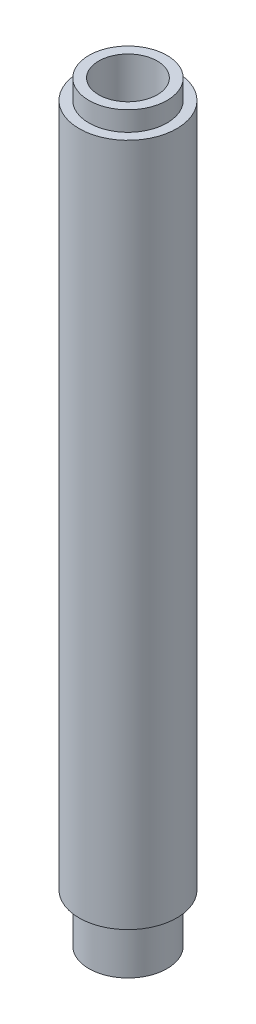
from build123d import *

# Parameters (mm, degrees)
SKETCH1_R           = 12.7
BOSS_EXTRUDE1_DEPTH = 177.8
SKETCH4_R           = 10.16
BOSS_EXTRUDE2_DEPTH = 5.08
SKETCH5_R           = 7.62
CUT_EXTRUDE1_DEPTH  = 184.759828036
SKETCH6_R           = 10.16
SKETCH6_R_2         = 7.62
BOSS_EXTRUDE3_DEPTH = 12.7


with BuildPart() as part:
    # Sketch1 → Boss-Extrude1 (new body)
    with BuildSketch(Plane(origin=(0, 0, 0), x_dir=(1, 0, 0), z_dir=(0, 1, 0))):
        Circle(SKETCH1_R)
    extrude(amount=BOSS_EXTRUDE1_DEPTH)

    # Sketch4 → Boss-Extrude2 (add)
    with BuildSketch(Plane(origin=(0, 177.8, 0), x_dir=(1, 0, 0), z_dir=(0, 1, 0))):
        Circle(SKETCH4_R)
    extrude(amount=BOSS_EXTRUDE2_DEPTH)

    # Sketch5 → Cut-Extrude1 (cut, through all)
    with BuildSketch(Plane(origin=(0, 182.88, 0), x_dir=(1, 0, 0), z_dir=(0, 1, 0))):
        Circle(SKETCH5_R)
    extrude(amount=-CUT_EXTRUDE1_DEPTH, mode=Mode.SUBTRACT)

    # Sketch6 → Boss-Extrude3 (add)
    with BuildSketch(Plane.XZ):
        Circle(SKETCH6_R)
        Circle(SKETCH6_R_2, mode=Mode.SUBTRACT)
    extrude(amount=BOSS_EXTRUDE3_DEPTH)


solid = part.part
